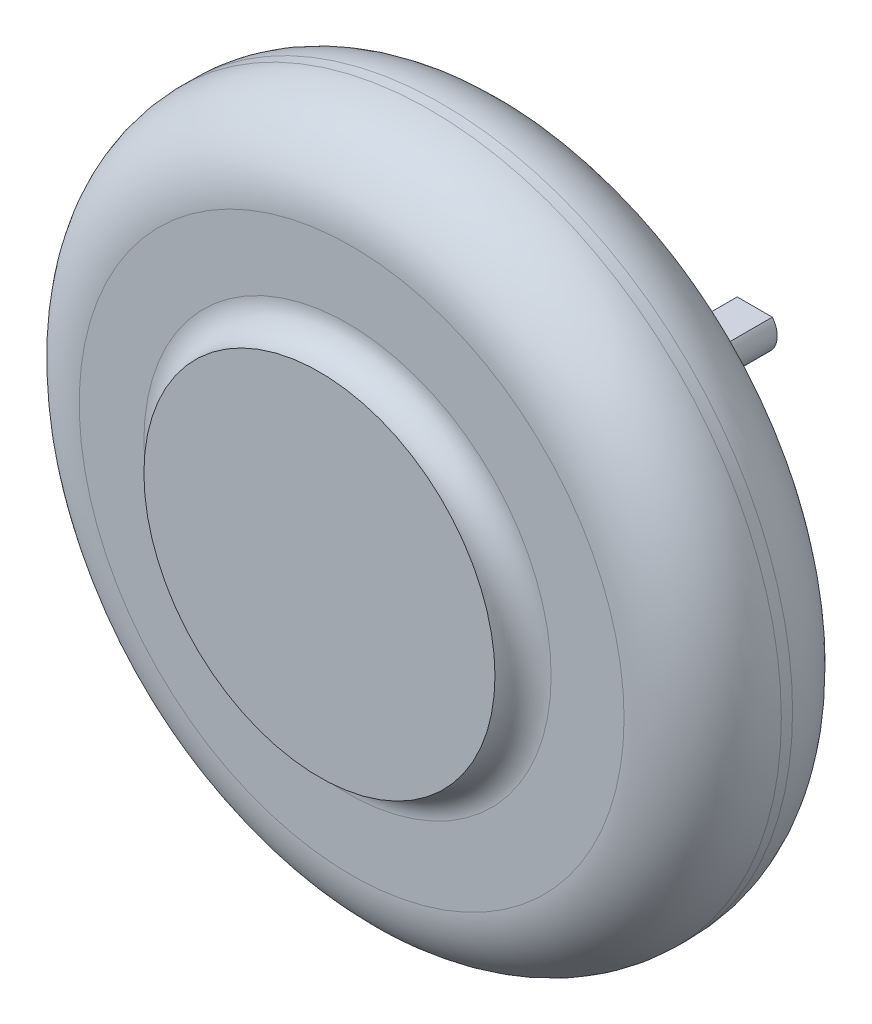
from build123d import *

# Parameters (mm, degrees)
SCHIZZO1_R                    = 125
ESTRUSIONE_ESTRUSIONE1_DEPTH  = 60
SCHIZZO2_R                    = 62.5
ESTRUSIONE_ESTRUSIONE2_DEPTH  = 10
SCHIZZO3_R                    = 22.5
ESTRUSIONE_ESTRUSIONE3_DEPTH  = 15
SCHIZZO4_R                    = 8
ESTRUSIONE_ESTRUSIONE4_DEPTH  = 70
RACCORDO1_R                   = 10
RACCORDO2_R                   = 28
TAGLIO_ESTRUSIONE1_DEPTH      = 236.887520145
TAGLIO_ESTRUSIONE1_DEPTH_BACK = 45


with BuildPart() as part:
    # Schizzo1 → Estrusione-Estrusione1 (new body)
    with BuildSketch(Plane.XY):
        with Locations((1.463125693, 0)):
            Circle(SCHIZZO1_R)
    extrude(amount=ESTRUSIONE_ESTRUSIONE1_DEPTH)

    # Schizzo2 → Estrusione-Estrusione2 (add)
    with BuildSketch(Plane.XY.offset(60)):
        Circle(SCHIZZO2_R)
    extrude(amount=ESTRUSIONE_ESTRUSIONE2_DEPTH)

    # Schizzo3 → Estrusione-Estrusione3 (add)
    with BuildSketch(Plane(origin=(0, 0, 0), x_dir=(-1, 0, 0), z_dir=(0, 0, -1))):
        Circle(SCHIZZO3_R)
    extrude(amount=ESTRUSIONE_ESTRUSIONE3_DEPTH)

    # Schizzo4 → Estrusione-Estrusione4 (add)
    with BuildSketch(Plane(origin=(0, 0, -15), x_dir=(-1, 0, 0), z_dir=(0, 0, -1))):
        Circle(SCHIZZO4_R)
    extrude(amount=ESTRUSIONE_ESTRUSIONE4_DEPTH)

    # Raccordo1
    raccordo1_edges = [part.edges().sort_by_distance(p)[0] for p in [
        (-62.5, 0, 60),
        (22.5, 0, 0),
    ]]
    fillet(raccordo1_edges, radius=RACCORDO1_R - 0.0001)  # a hair under: the kernel refuses the full size

    # Raccordo2
    raccordo2_edges = [part.edges().sort_by_distance(p)[0] for p in [
        (-123.536874307, 0, 0),
        (-123.536874307, 0, 60),
    ]]
    fillet(raccordo2_edges, radius=RACCORDO2_R)

    # Schizzo5 → Taglio-Estrusione1 (cut, two sides: drawn at the far end of the back side and taken through both)
    with BuildSketch(Plane(origin=(0, 0, -85), x_dir=(-1, 0, 0), z_dir=(0, 0, -1)).offset(-TAGLIO_ESTRUSIONE1_DEPTH_BACK)):
        Polygon((-387.790129005, 5), (-6.244997998, 5), (6.244997998, 5), (387.790129005, 5), (387.790129005, 768.090262014), (-387.790129005, 768.090262014), align=None)
    extrude(amount=TAGLIO_ESTRUSIONE1_DEPTH + TAGLIO_ESTRUSIONE1_DEPTH_BACK, mode=Mode.SUBTRACT)


solid = part.part
